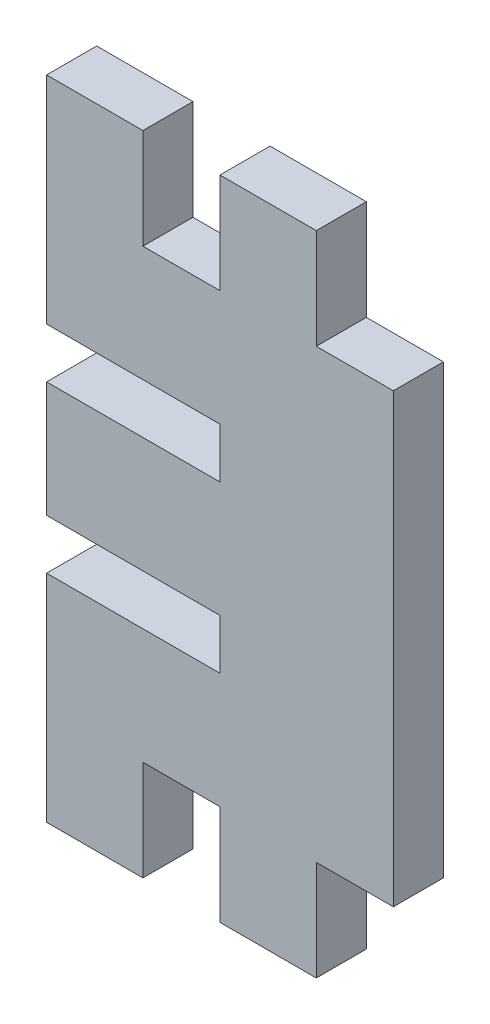
from build123d import *

# Parameters (mm, degrees)
BOSS_EXTRUDE2_DEPTH = 5.2


with BuildPart() as part:
    # Sketch1 → Boss-Extrude2 (new body)
    with BuildSketch(Plane.XY):
        Polygon((-18, 6), (-18, -6), (0, -6), (0, -11.2), (-18, -11.2), (-18, -33.6), (-8, -33.6), (-8, -23.2), (0, -23.2), (0, -33.6), (10, -33.6), (10, -23.2), (18, -23.2), (18, 23.2), (10, 23.2), (10, 33.6), (0, 33.6), (0, 23.2), (-8, 23.2), (-8, 33.6), (-18, 33.6), (-18, 11.2), (0, 11.2), (0, 6), align=None)
    extrude(amount=BOSS_EXTRUDE2_DEPTH)


solid = part.part
